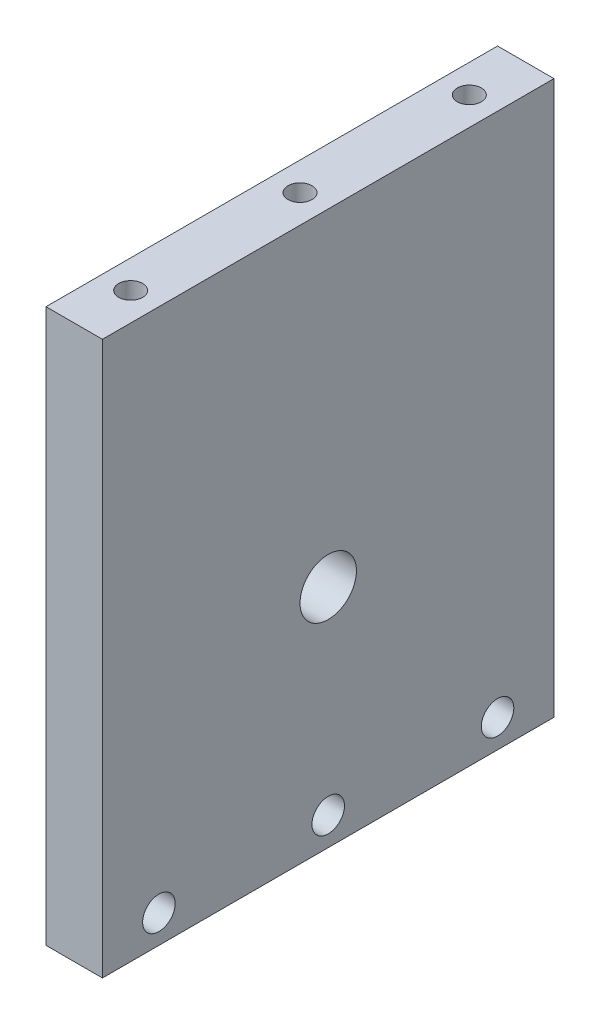
from build123d import *

# Parameters (mm, degrees)
SKETCH1_W                 = 50.8
SKETCH1_H                 = 62.23
BOSS_EXTRUDE1_DEPTH       = 6.35
SKETCH3_R                 = 1.8288
CUT_EXTRUDE1_DEPTH        = 6.35
F_6_32_TAPPED_HOLE1_D     = 2.7051
F_6_32_TAPPED_HOLE1_DEPTH = 11.88730597
F_6_32_TAPPED_HOLE1_TIP   = 0.81269403
SKETCH12_R                = 3.175
CUT_EXTRUDE3_DEPTH        = 6.35


with BuildPart() as part:
    # Sketch1 → Boss-Extrude1 (new body)
    with BuildSketch(Plane(origin=(0, 0, 0), x_dir=(0, 0, -1), z_dir=(1, 0, 0))):
        with Locations((-25.4, 31.115)):
            Rectangle(SKETCH1_W, SKETCH1_H)
    extrude(amount=BOSS_EXTRUDE1_DEPTH)

    # Sketch3 → Cut-Extrude1 (cut)
    with BuildSketch(Plane(origin=(6.35, 0, 0), x_dir=(0, 0, -1), z_dir=(1, 0, 0))):
        with Locations((-44.45, 3.175)):
            Circle(SKETCH3_R)
        with Locations((-25.4, 3.175)):
            Circle(SKETCH3_R)
        with Locations((-6.35, 3.175)):
            Circle(SKETCH3_R)
    extrude(amount=-CUT_EXTRUDE1_DEPTH, mode=Mode.SUBTRACT)

    # #6-32 Tapped Hole1
    with Locations(Plane(origin=(0, 62.23, 0), x_dir=(1, 0, 0), z_dir=(0, 1, 0))):
        with Locations((3.175, -6.35), (3.175, -25.4), (3.175, -44.45)):
            Hole(F_6_32_TAPPED_HOLE1_D / 2, depth=F_6_32_TAPPED_HOLE1_DEPTH)
            with Locations((0, 0, -(F_6_32_TAPPED_HOLE1_DEPTH + F_6_32_TAPPED_HOLE1_TIP / 2))):  # 118° drill point
                Cone(0, F_6_32_TAPPED_HOLE1_D / 2, F_6_32_TAPPED_HOLE1_TIP, mode=Mode.SUBTRACT)

    # Sketch12 → Cut-Extrude3 (cut)
    with BuildSketch(Plane(origin=(6.35, 0, 0), x_dir=(0, 0, -1), z_dir=(1, 0, 0))):
        with Locations((-25.4, 25.4)):
            Circle(SKETCH12_R)
    extrude(amount=-CUT_EXTRUDE3_DEPTH, mode=Mode.SUBTRACT)


solid = part.part
